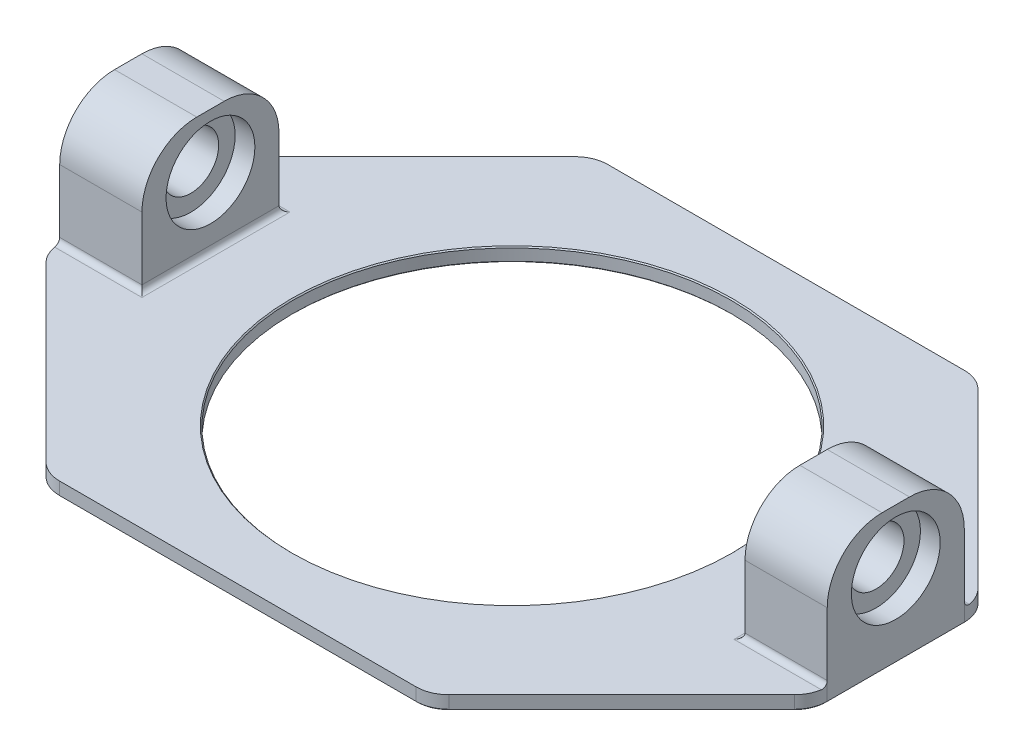
from build123d import *

# Parameters (mm, degrees)
SKETCH_1_W          = 280
SKETCH_1_H          = 280
EXTRUDE_1_DEPTH     = 5
SKETCH_2_R          = 80
CUT_EXTRUDE_1_DEPTH = 5
SKETCH_3_W          = 30
SKETCH_3_H          = 50
EXTRUDE_2_DEPTH     = 45
SKETCH_4_R          = 10.2
CUT_EXTRUDE_2_DEPTH = 400.12404087
SKETCH_5_R          = 16.2
CUT_EXTRUDE_3_DEPTH = 7.2
CUT_EXTRUDE_START   = -7.2
SKETCH_6_R          = 16.2
CUT_EXTRUDE_4_DEPTH = 7.2
SKETCH_7_R          = 16.2
CUT_EXTRUDE_5_DEPTH = 7.2
SKETCH_8_R          = 16.2
CUT_EXTRUDE_6_DEPTH = 7.2
SKETCH_9_W          = 280
SKETCH_9_H          = 80
CUT_EXTRUDE_7_DEPTH = 399.52854352
CHAMFER_1_SIZE      = 70
FILLET_1_R          = 20
FILLET_2_R          = 12
CHAMFER_2_SIZE      = 0.4
FILLET_3_R          = 2
SKETCH_10_R         = 1.6
CUT_EXTRUDE_8_DEPTH = 20
SKETCH_11_R         = 2.35
CUT_EXTRUDE_9_DEPTH = 4.2
CHAMFER_4_SIZE      = 0.4


with BuildPart() as part:
    # 草图1 → 凸台-拉伸1 (new body)
    with BuildSketch(Plane(origin=(0, 0, 0), x_dir=(1, 0, 0), z_dir=(0, 1, 0))):
        with Locations((140, -140)):
            Rectangle(SKETCH_1_W, SKETCH_1_H)
    extrude(amount=EXTRUDE_1_DEPTH)

    # 草图2 → 切除-拉伸1 (cut)
    with BuildSketch(Plane(origin=(0, 5, 0), x_dir=(1, 0, 0), z_dir=(0, 1, 0))):
        with Locations((140, -180)):
            Circle(SKETCH_2_R)
    extrude(amount=-CUT_EXTRUDE_1_DEPTH, mode=Mode.SUBTRACT)

    # 草图3 → 凸台-拉伸2 (add)
    with BuildSketch(Plane(origin=(0, 5, 0), x_dir=(1, 0, 0), z_dir=(0, 1, 0))):
        with Locations((15, -180)):
            Rectangle(SKETCH_3_W, SKETCH_3_H)
        with Locations((265, -180)):
            Rectangle(SKETCH_3_W, SKETCH_3_H)
    extrude(amount=EXTRUDE_2_DEPTH)

    # 草图4 → 切除-拉伸2 (cut, through all)
    with BuildSketch(Plane(origin=(280, 0, 0), x_dir=(0, 0, -1), z_dir=(1, 0, 0))):
        with Locations((-180, 30)):
            Circle(SKETCH_4_R)
    extrude(amount=-CUT_EXTRUDE_2_DEPTH, mode=Mode.SUBTRACT)

    # 草图5 → 切除-拉伸3 (cut)
    with BuildSketch(Plane(origin=(280, 0, 0), x_dir=(0, 0, -1), z_dir=(1, 0, 0))):
        with Locations((-180, 30)):
            Circle(SKETCH_5_R)
    extrude(amount=-CUT_EXTRUDE_3_DEPTH, mode=Mode.SUBTRACT)

    # 草图6 → 切除-拉伸4 (cut)
    with BuildSketch(Plane.ZY.offset(-250).offset(CUT_EXTRUDE_START)):
        with Locations((180, 30)):
            Circle(SKETCH_6_R)
    extrude(amount=CUT_EXTRUDE_4_DEPTH, mode=Mode.SUBTRACT)

    # 草图7 → 切除-拉伸5 (cut)
    with BuildSketch(Plane(origin=(30, 0, 0), x_dir=(0, 0, -1), z_dir=(1, 0, 0))):
        with Locations((-180, 30)):
            Circle(SKETCH_7_R)
    extrude(amount=-CUT_EXTRUDE_5_DEPTH, mode=Mode.SUBTRACT)

    # 草图8 → 切除-拉伸6 (cut)
    with BuildSketch(Plane.ZY.offset(CUT_EXTRUDE_START)):
        with Locations((180, 30)):
            Circle(SKETCH_8_R)
    extrude(amount=CUT_EXTRUDE_6_DEPTH, mode=Mode.SUBTRACT)

    # 草图9 → 切除-拉伸7 (cut, through all)
    with BuildSketch(Plane(origin=(0, 5, 0), x_dir=(1, 0, 0), z_dir=(0, 1, 0))):
        with Locations((140, -40)):
            Rectangle(SKETCH_9_W, SKETCH_9_H)
    extrude(amount=-CUT_EXTRUDE_7_DEPTH, mode=Mode.SUBTRACT)

    # 倒角1
    chamfer_1_edges = [part.edges().sort_by_distance(p)[0] for p in [
        (280, 2.5, 80),
        (280, 2.5, 280),
        (0, 2.5, 280),
        (0, 2.5, 80),
    ]]
    chamfer(chamfer_1_edges, length=CHAMFER_1_SIZE)

    # 圆角1
    fillet_1_edges = [part.edges().sort_by_distance(p)[0] for p in [
        (265, 50, 205),
        (265, 50, 155),
        (15, 50, 205),
        (15, 50, 155),
    ]]
    fillet(fillet_1_edges, radius=FILLET_1_R)

    # 圆角2
    fillet_2_edges = [part.edges().sort_by_distance(p)[0] for p in [
        (70, 2.5, 80),
        (210, 2.5, 80),
        (280, 2.5, 150),
        (280, 2.5, 210),
        (210, 2.5, 280),
        (70, 2.5, 280),
        (0, 2.5, 210),
        (0, 2.5, 150),
    ]]
    fillet(fillet_2_edges, radius=FILLET_2_R)

    # 倒角2
    chamfer_2_edges = [part.edges().sort_by_distance(p)[0] for p in [
        (60, 5, 180),
    ]]
    chamfer(chamfer_2_edges, length=CHAMFER_2_SIZE)

    # 圆角3
    fillet_3_edges = [part.edges().sort_by_distance(p)[0] for p in [
        (250, 5, 180),
        (265, 5, 205),
        (265, 5, 155),
        (15, 5, 155),
        (30, 5, 180),
        (15, 5, 205),
    ]]
    fillet(fillet_3_edges, radius=FILLET_3_R)

    # 草图10 → 切除-拉伸8 (cut)
    with BuildSketch(Plane(origin=(0, 0, 0), x_dir=(-1, 0, 0), z_dir=(0, -1, 0))):
        with Locations((-20, -187.5)):
            Circle(SKETCH_10_R)
        with Locations((-20, -172.5)):
            Circle(SKETCH_10_R)
        with Locations((-260, -187.5)):
            Circle(SKETCH_10_R)
        with Locations((-260, -172.5)):
            Circle(SKETCH_10_R)
    extrude(amount=-CUT_EXTRUDE_8_DEPTH, mode=Mode.SUBTRACT)

    # 草图11 → 切除-拉伸9 (cut)
    with BuildSketch(Plane(origin=(0, 0, 0), x_dir=(-1, 0, 0), z_dir=(0, -1, 0))):
        with Locations((-20, -172.5)):
            Circle(SKETCH_11_R)
        with Locations((-20, -187.5)):
            Circle(SKETCH_11_R)
        with Locations((-260, -172.5)):
            Circle(SKETCH_11_R)
        with Locations((-260, -187.5)):
            Circle(SKETCH_11_R)
    extrude(amount=-CUT_EXTRUDE_9_DEPTH, mode=Mode.SUBTRACT)

    # 倒角4
    chamfer_4_edges = [part.edges().sort_by_distance(p)[0] for p in [
        (0.91344561, 0, 150.37836156),
        (0, 0, 180),
        (0.91344561, 0, 209.62163844),
        (35, 0, 245),
        (70.37836156, 0, 279.08655439),
        (140, 0, 280),
        (209.62163844, 0, 279.08655439),
        (245, 0, 245),
        (279.08655439, 0, 209.62163844),
        (280, 0, 180),
        (279.08655439, 0, 150.37836156),
        (245, 0, 115),
        (209.62163844, 0, 80.91344561),
        (140, 0, 80),
        (70.37836156, 0, 80.91344561),
        (35, 0, 115),
        (60, 0, 180),
        (22.35, 0, 172.5),
        (262.35, 0, 187.5),
        (262.35, 0, 172.5),
        (22.35, 0, 187.5),
    ]]
    chamfer(chamfer_4_edges, length=CHAMFER_4_SIZE)


solid = part.part
